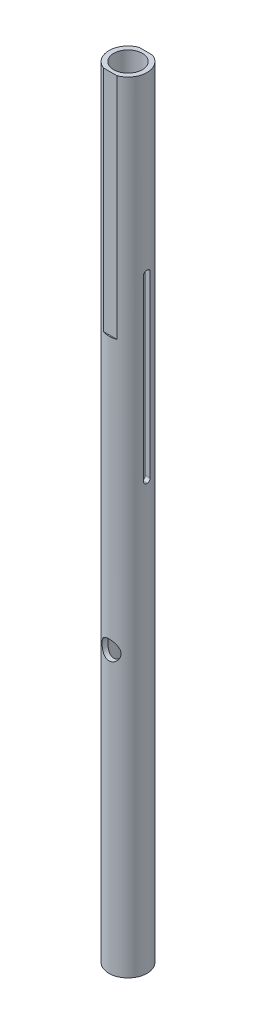
from build123d import *

# Parameters (mm, degrees)
SKETCH1_R                = 20
SKETCH1_R_2              = 15
BOSS_EXTRUDE1_DEPTH      = 380
SKETCH8_R                = 20
BOSS_EXTRUDE3_DEPTH      = 60
CUT_EXTRUDE2_START       = -899.5
SKETCH9_R                = 15
CUT_EXTRUDE2_DEPTH       = 899.5
CUT_EXTRUDE16_DEPTH      = 240
CUT_EXTRUDE17_DEPTH      = 20
CUT_EXTRUDE17_DEPTH_BACK = 20
CUT_EXTRUDE19_DEPTH      = 10
CUT_EXTRUDE19_DEPTH_BACK = 10
SKETCH26_R               = 10
CUT_EXTRUDE20_DEPTH      = 30
CUT_EXTRUDE20_DEPTH_BACK = 20
SKETCH27_R               = 3.4


with BuildPart() as part:
    # Sketch1 → Boss-Extrude1 (new, symmetric)
    with BuildSketch(Plane(origin=(0, 0, 0), x_dir=(1, 0, 0), z_dir=(0, 1, 0))):
        Circle(SKETCH1_R)
        Circle(SKETCH1_R_2, mode=Mode.SUBTRACT)
    extrude(amount=BOSS_EXTRUDE1_DEPTH, both=True)

    # Sketch8 → Boss-Extrude3 (add)
    with BuildSketch(Plane.XZ.offset(380)):
        Circle(SKETCH8_R)
    extrude(amount=BOSS_EXTRUDE3_DEPTH)

    # Sketch9 → Cut-Extrude2 (cut)
    with BuildSketch(Plane(origin=(-32.302786122, 416.289190775, -45.221901395), x_dir=(-0.9768887275019512, 0, 0.2137484832217963), z_dir=(0, 1, 0)).offset(CUT_EXTRUDE2_START)):
        with Locations((-21.890114798, 51.081437247)):
            Circle(SKETCH9_R)
    extrude(amount=CUT_EXTRUDE2_DEPTH, mode=Mode.SUBTRACT)

    # Sketch23 → Cut-Extrude16 (cut)
    with BuildSketch(Plane(origin=(0, 380, 0), x_dir=(1, 0, 0), z_dir=(0, 1, 0))):
        with BuildLine():
            Line((-7, 18.734993995), (7, 18.734993995))
            ThreePointArc((7, 18.734993995), (0, 20), (-7, 18.734993995))
        make_face()
    cut_extrude16 = extrude(amount=-CUT_EXTRUDE16_DEPTH, mode=Mode.SUBTRACT)

    # Mirror1: Cut-Extrude16 across plane
    add(cut_extrude16.mirror(Plane.XY), mode=Mode.SUBTRACT)

    # Sketch24 → Cut-Extrude17 (cut, two sides: drawn at the far end of the back side and taken through both)
    with BuildSketch(Plane(origin=(0, 0, 0), x_dir=(0, 0, -1), z_dir=(1, 0, 0)).offset(-CUT_EXTRUDE17_DEPTH_BACK)):
        with BuildLine():
            Line((-0.5, 200), (0.5, 200))
            ThreePointArc((0.5, 200), (2.621320344, 199.121320344), (3.5, 197))
            Line((3.5, 197), (3.5, 9))
            ThreePointArc((3.5, 9), (2.621320344, 6.878679656), (0.5, 6))
            Line((0.5, 6), (-0.5, 6))
            ThreePointArc((-0.5, 6), (-2.621320344, 6.878679656), (-3.5, 9))
            Line((-3.5, 9), (-3.5, 197))
            ThreePointArc((-3.5, 197), (-2.621320344, 199.121320344), (-0.5, 200))
        make_face()
    extrude(amount=CUT_EXTRUDE17_DEPTH + CUT_EXTRUDE17_DEPTH_BACK, mode=Mode.SUBTRACT)

    # Sketch26 → Cut-Extrude19 (cut, two sides: drawn at the far end of the back side and taken through both)
    with BuildSketch(Plane(origin=(0, -44.33037899, 18.734993995), x_dir=(1, 0, 0), z_dir=(0, 0, 1)).offset(-CUT_EXTRUDE19_DEPTH_BACK)):
        with Locations((0, -101.15698714)):
            Circle(SKETCH26_R)
    extrude(amount=CUT_EXTRUDE19_DEPTH + CUT_EXTRUDE19_DEPTH_BACK, mode=Mode.SUBTRACT)

    # Sketch27 → Cut-Extrude20 (cut, two sides: drawn at the far end of the back side and taken through both)
    with BuildSketch(Plane(origin=(0, -44.33037899, -18.734993995), x_dir=(-1, 0, 0), z_dir=(0, 0, -1)).offset(-CUT_EXTRUDE20_DEPTH_BACK)):
        with Locations((0, -273.66962101)):
            Circle(SKETCH27_R)
        with Locations((0, -288.66962101)):
            Circle(SKETCH27_R)
    extrude(amount=CUT_EXTRUDE20_DEPTH + CUT_EXTRUDE20_DEPTH_BACK, mode=Mode.SUBTRACT)


solid = part.part
